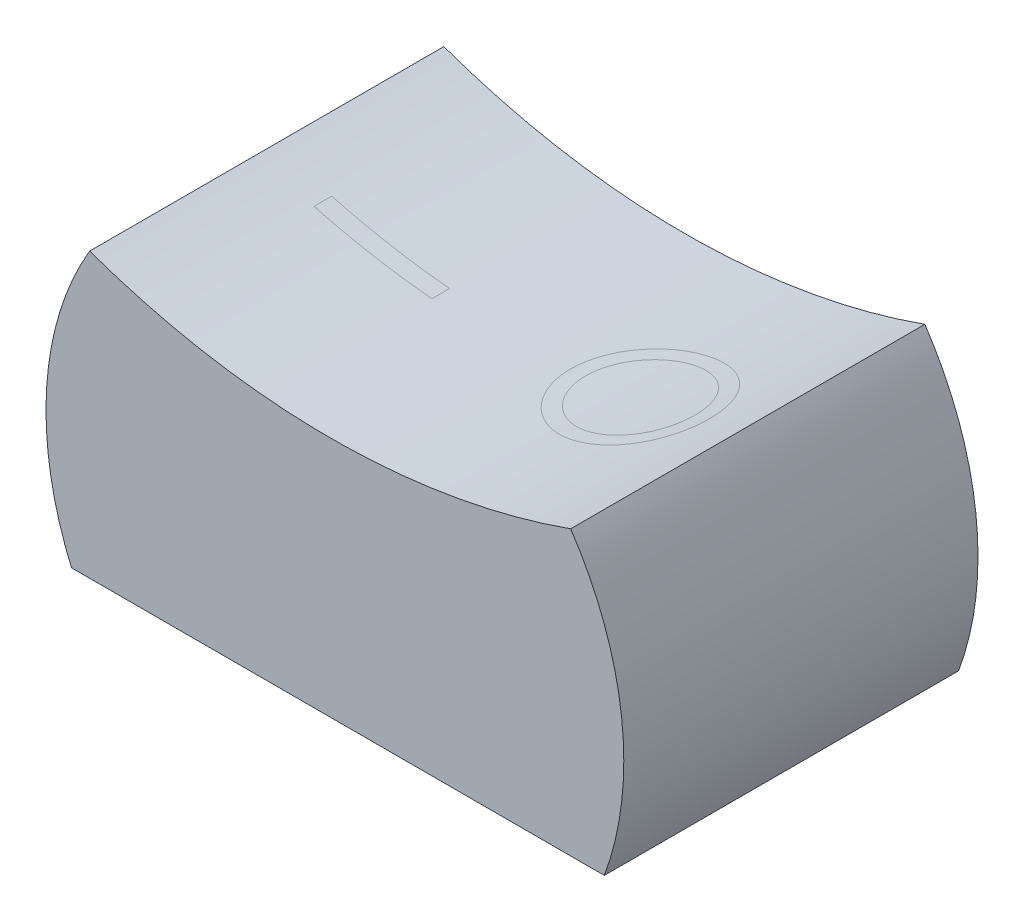
from build123d import *

# Parameters (mm, degrees)
Y_KSEKLIK_EKSTR_ZYON1_DEPTH = 10
BO_ALTMA1_T                 = -1


with BuildPart() as part:
    # Çizim1 → Yükseklik-Ekstrüzyon1 (new body)
    with BuildSketch(Plane.XY):
        with BuildLine():
            Line((-7.872610776, -1.236747632), (0, -1.236747632))
            Line((0, -1.236747632), (7.170282206, -1.236747632))
            ThreePointArc((7.170282206, -1.236747632), (7.658566861, 2.877609153), (6.22046726, 6.763252368))
            ThreePointArc((6.22046726, 6.763252368), (-0.569471156, 5.591352338), (-7.359409573, 6.763252368))
            ThreePointArc((-7.359409573, 6.763252368), (-8.573870762, 2.824699269), (-7.872610776, -1.236747632))
        make_face()
    extrude(amount=Y_KSEKLIK_EKSTR_ZYON1_DEPTH)

    # İç Boşaltma1
    bo_altma1_openings = [part.faces().sort_by_distance(p)[0] for p in [
        (-0.351164285, -1.236747632, 5),
    ]]
    offset(amount=BO_ALTMA1_T, openings=bo_altma1_openings, kind=Kind.INTERSECTION)


solid = part.part
